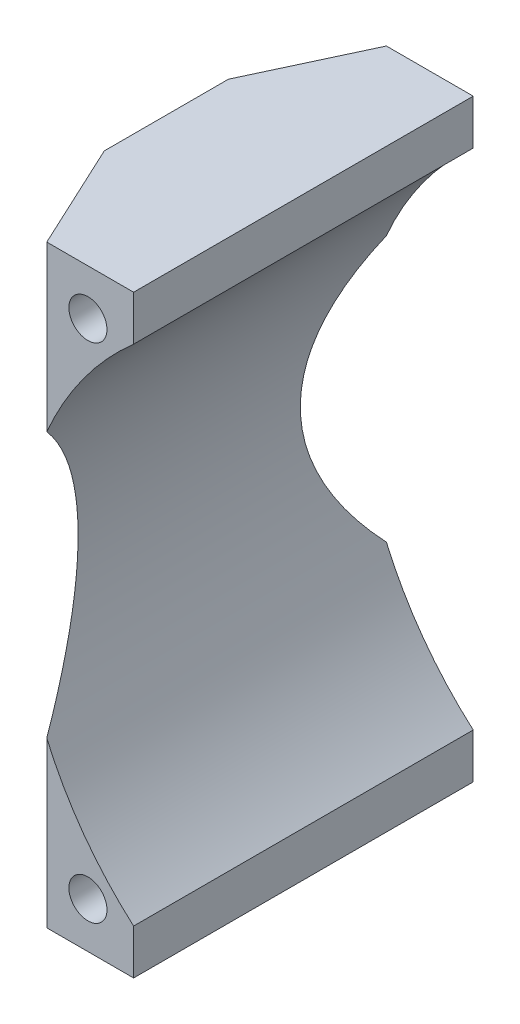
from build123d import *

# Parameters (mm, degrees)
SKETCH_1_W                       = 8.5
SKETCH_1_H                       = 39
EXTRUDE_1_DEPTH                  = 22.3
SKETCH_2_R                       = 22
CUT_EXTRUDE_2_DEPTH              = 22.3
HOLE_WIZARD_M3_1_D               = 2.5
HOLE_WIZARD_M3_1_DEPTH           = 9.5
HOLE_WIZARD_M3_1_TIP             = 0.751075774
HOLE_WIZARD_M3_2_D               = 2.5
HOLE_WIZARD_M3_2_DEPTH           = 9.5
HOLE_WIZARD_M3_2_TIP             = 0.751075774
HOLE_WIZARD_M3_3_D               = 2.5
HOLE_WIZARD_M3_3_DEPTH           = 9.5
HOLE_WIZARD_M3_3_TIP             = 0.751075774
HOLE_WIZARD_M3_3_ON_FACE_2_D     = 2.5
HOLE_WIZARD_M3_3_ON_FACE_2_DEPTH = 9.5
HOLE_WIZARD_M3_3_ON_FACE_2_TIP   = 0.751075774
CHAMFER_2_SIZE                   = 6
CHAMFER_2_SIZE_2                 = 2.797845949
CHAMFER_5_SIZE                   = 2.797845949
CHAMFER_5_SIZE_2                 = 6
EXTRUDE_5_DEPTH                  = 39


with BuildPart() as part:
    # 草图1 → 拉伸1 (new body)
    with BuildSketch(Plane.XY):
        with Locations((-4.25, 0)):
            Rectangle(SKETCH_1_W, SKETCH_1_H)
    extrude(amount=EXTRUDE_1_DEPTH)

    # 草图2 → 拉伸2 (cut)
    with BuildSketch(Plane.XY.offset(22.3)):
        with Locations((14.5, 0)):
            Circle(SKETCH_2_R)
    extrude(amount=-CUT_EXTRUDE_2_DEPTH, mode=Mode.SUBTRACT)

    # M3 螺纹孔1
    with Locations(Plane(origin=(-3, 16.5, 22.3), x_dir=(1, 0, 0), z_dir=(0, 0, 1))):
        with Locations((0, 0)):
            Hole(HOLE_WIZARD_M3_1_D / 2, depth=HOLE_WIZARD_M3_1_DEPTH)
            with Locations((0, 0, -(HOLE_WIZARD_M3_1_DEPTH + HOLE_WIZARD_M3_1_TIP / 2))):  # 118° drill point
                Cone(0, HOLE_WIZARD_M3_1_D / 2, HOLE_WIZARD_M3_1_TIP, mode=Mode.SUBTRACT)

    # M3 螺纹孔2
    with Locations(Plane(origin=(-3, 16.5, 0), x_dir=(-1, 0, 0), z_dir=(0, 0, -1))):
        with Locations((0, 0)):
            Hole(HOLE_WIZARD_M3_2_D / 2, depth=HOLE_WIZARD_M3_2_DEPTH)
            with Locations((0, 0, -(HOLE_WIZARD_M3_2_DEPTH + HOLE_WIZARD_M3_2_TIP / 2))):  # 118° drill point
                Cone(0, HOLE_WIZARD_M3_2_D / 2, HOLE_WIZARD_M3_2_TIP, mode=Mode.SUBTRACT)

    # M3 螺纹孔3
    with Locations(Plane(origin=(-3, -16.5, 22.3), x_dir=(1, 0, 0), z_dir=(0, 0, 1))):
        with Locations((0, 0)):
            Hole(HOLE_WIZARD_M3_3_D / 2, depth=HOLE_WIZARD_M3_3_DEPTH)
            with Locations((0, 0, -(HOLE_WIZARD_M3_3_DEPTH + HOLE_WIZARD_M3_3_TIP / 2))):  # 118° drill point
                Cone(0, HOLE_WIZARD_M3_3_D / 2, HOLE_WIZARD_M3_3_TIP, mode=Mode.SUBTRACT)

    # M3 螺纹孔3 on face 2
    with Locations(Plane(origin=(-3, -16.5, 0), x_dir=(-1, 0, 0), z_dir=(0, 0, -1))):
        with Locations((0, 0)):
            Hole(HOLE_WIZARD_M3_3_ON_FACE_2_D / 2, depth=HOLE_WIZARD_M3_3_ON_FACE_2_DEPTH)
            with Locations((0, 0, -(HOLE_WIZARD_M3_3_ON_FACE_2_DEPTH + HOLE_WIZARD_M3_3_ON_FACE_2_TIP / 2))):  # 118° drill point
                Cone(0, HOLE_WIZARD_M3_3_ON_FACE_2_D / 2, HOLE_WIZARD_M3_3_ON_FACE_2_TIP, mode=Mode.SUBTRACT)

    # 倒角2
    # the kernel refuses this chamfer: 6, 2.797845949 mm, written as the material it takes off along each edge
    with BuildSketch(Plane(origin=(-8.5, -35.045852829, 22.3), x_dir=(-0.01631116413111048, 0, -0.9998669641130704), z_dir=(0, 1, 0))) as chamfer_2_piece_1:
        Polygon((CHAMFER_2_SIZE * 0.999866964113, -CHAMFER_2_SIZE * 0.0163111641311), (-CHAMFER_2_SIZE_2 * 0.0163111641307, -CHAMFER_2_SIZE_2 * 0.999866964088), (0, 0), align=None)
    extrude(amount=70.091705657, mode=Mode.SUBTRACT)

    # 倒角5
    # the kernel refuses this chamfer: 6, 2.797845949 mm, written as the material it takes off along each edge
    with BuildSketch(Plane(origin=(-8.5, -35.045852829, 0), x_dir=(0.9971975577536775, 0, -0.07481330637059953), z_dir=(0, 1, 0))) as chamfer_5_piece_1:
        Polygon((CHAMFER_5_SIZE * 0.997197557729, -CHAMFER_5_SIZE * 0.0748133063687), (-CHAMFER_5_SIZE_2 * 0.0748133063706, -CHAMFER_5_SIZE_2 * 0.997197557754), (0, 0), align=None)
    extrude(amount=70.091705657, mode=Mode.SUBTRACT)

    # 草图8 → 拉伸5 (add)
    with BuildSketch(Plane(origin=(0, 19.5, 0), x_dir=(1, 0, 0), z_dir=(0, 1, 0))):
        Polygon((-8.5, -16.3), (-8.5, -6), (-9, -7.07225346), (-9, -15.22774654), align=None)
    extrude(amount=-EXTRUDE_5_DEPTH)


solid = part.part
